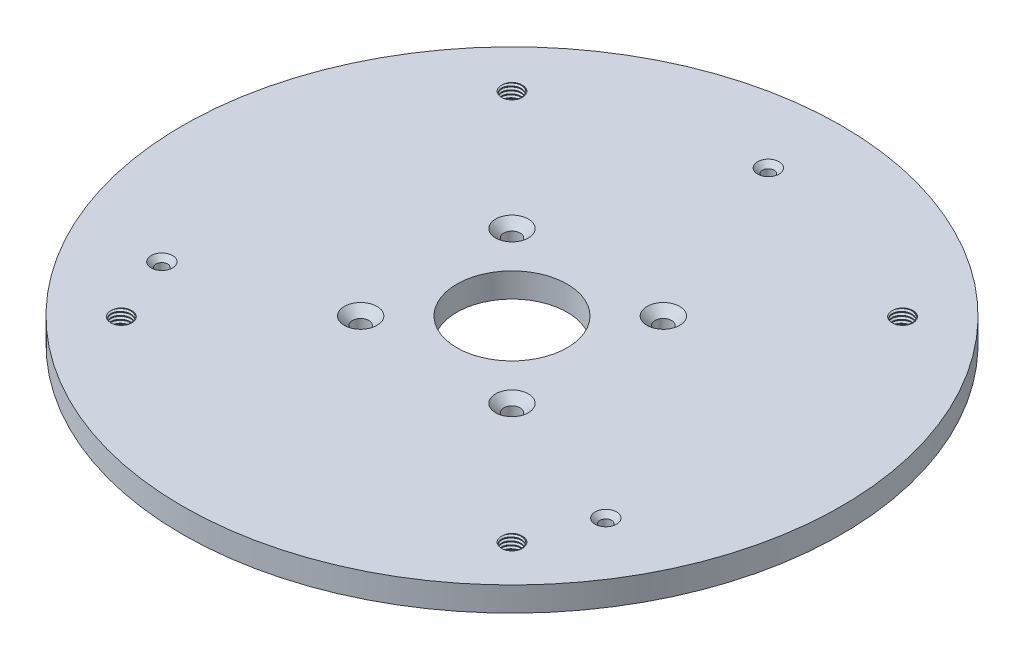
from build123d import *

# Parameters (mm, degrees)
SKETCH1_R                                           = 67.5
BOSS_EXTRUDE1_DEPTH                                 = 5
CSK_FOR_M3_SFHCS1_D                                 = 3.4
CSK_FOR_M3_SFHCS1_CSINK_D                           = 6.72
CSK_FOR_M3_SFHCS1_CSINK_ANGLE                       = 90
SKETCH5_R                                           = 11.3
CUT_EXTRUDE1_DEPTH                                  = 96.590271472
F_4_0MM_DOWEL_HOLE1_D                               = 4
F_4_0MM_DOWEL_HOLE1_DEPTH                           = 15
F_4_0MM_DOWEL_HOLE1_TIP                             = 1.201721238
THREAD1_PITCH                                       = 0.7
THREAD2_PITCH                                       = 0.7
THREAD3_PITCH                                       = 0.7
THREAD4_PITCH                                       = 0.7
CSK_FOR_M2_COUNTERSUNK_FLAT_HEAD_SCREW1_D           = 2.4
CSK_FOR_M2_COUNTERSUNK_FLAT_HEAD_SCREW1_CSINK_D     = 4.4
CSK_FOR_M2_COUNTERSUNK_FLAT_HEAD_SCREW1_CSINK_ANGLE = 90


with BuildPart() as part:
    # Sketch1 → Boss-Extrude1 (new body)
    with BuildSketch(Plane(origin=(0, 0, 0), x_dir=(1, 0, 0), z_dir=(0, 1, 0))):
        with Locations(Location((0, 0, 0), (0, 0, 270))):
            Circle(SKETCH1_R)
    extrude(amount=BOSS_EXTRUDE1_DEPTH)

    # CSK for M3 SFHCS1 (through all)
    with Locations(Plane(origin=(0, 5, 0), x_dir=(1, 0, 0), z_dir=(0, 1, 0))):
        with Locations((-15.5, 15.5), (15.5, 15.5), (15.5, -15.5), (-15.5, -15.5)):
            CounterSinkHole(CSK_FOR_M3_SFHCS1_D / 2, CSK_FOR_M3_SFHCS1_CSINK_D / 2, counter_sink_angle=CSK_FOR_M3_SFHCS1_CSINK_ANGLE)

    # Sketch5 → Cut-Extrude1 (cut, through all)
    with BuildSketch(Plane(origin=(0, 5, 0), x_dir=(1, 0, 0), z_dir=(0, 1, 0))):
        with Locations(Location((0, 0, 0), (0, 0, 270))):
            Circle(SKETCH5_R)
    extrude(amount=-CUT_EXTRUDE1_DEPTH, mode=Mode.SUBTRACT)

    # Ø4.0mm Dowel Hole1
    with Locations(Plane(origin=(0, 5, 0), x_dir=(1, 0, 0), z_dir=(0, 1, 0))):
        with Locations((40, 40), (-40, 40), (-40, -40), (40, -40)):
            Hole(F_4_0MM_DOWEL_HOLE1_D / 2, depth=F_4_0MM_DOWEL_HOLE1_DEPTH)
            with Locations((0, 0, -(F_4_0MM_DOWEL_HOLE1_DEPTH + F_4_0MM_DOWEL_HOLE1_TIP / 2))):  # 118° drill point
                Cone(0, F_4_0MM_DOWEL_HOLE1_D / 2, F_4_0MM_DOWEL_HOLE1_TIP, mode=Mode.SUBTRACT)

    # Thread1: the profile of Thread Profile2 profile screwed along a right-hand helix of 8.142857 turns, 6 arcs to a turn; built about Z, then put on its axis
    thread1_z = Axis((0, 0, 0), (0, 0, 1))
    thread1_corners = [(1.9997, 1e-09, -0.000173205), (2.378886112, 1e-09, 0.218749999), (2.378886112, 1e-09, 0.306249999), (1.9997, 1e-09, 0.525173203)]
    with BuildLine(mode=Mode.PRIVATE) as thread1_profile:
        Line(thread1_corners[0], thread1_corners[1])
        Line(thread1_corners[1], thread1_corners[2])
        Line(thread1_corners[2], thread1_corners[3])
        Line(thread1_corners[3], thread1_corners[0])
    thread1_cap = Face(thread1_profile.wire())
    thread1_turn_angles = [0, 30, 60, 90, 120, 150, 180, 210, 240, 270, 300, 330, 360]
    thread1_turn_weights = [1, 0.8660254037844387, 1, 0.8660254037844387, 1, 0.8660254037844387, 1, 0.8660254037844387, 1, 0.8660254037844387, 1, 0.8660254037844387, 1]
    thread1_turn_rails = [Edge.make_bspline([Vector(p[0], p[1], 0).rotate(thread1_z, thread1_turn_angles[k]) / thread1_turn_weights[k] + Vector(0, 0, p[2] + THREAD1_PITCH * thread1_turn_angles[k] / 360) for k in range(13)], [0, 0, 0, 1, 1, 2, 2, 3, 3, 4, 4, 5, 5, 6, 6, 6], 2, thread1_turn_weights) for p in thread1_corners]
    thread1_turn_sides = [Face.make_surface_from_curves(thread1_turn_rails[p[0]], thread1_turn_rails[p[1]]) for p in [(0, 1), (1, 2), (2, 3), (3, 0)]]
    thread1_last_angles = [2880, 2905.714285714, 2931.428571429]
    thread1_last_weights = [1, 0.9009688679024135, 1]
    thread1_last_rails = [Edge.make_bspline([Vector(p[0], p[1], 0).rotate(thread1_z, thread1_last_angles[k]) / thread1_last_weights[k] + Vector(0, 0, p[2] + THREAD1_PITCH * thread1_last_angles[k] / 360) for k in range(3)], [0, 0, 0, 1, 1, 1], 2, thread1_last_weights) for p in thread1_corners]
    thread1_last_sides = [Face.make_surface_from_curves(thread1_last_rails[p[0]], thread1_last_rails[p[1]]) for p in [(0, 1), (1, 2), (2, 3), (3, 0)]]
    thread1 = Plane(origin=(-40, 5.7, 40), x_dir=(-0.999847695, 0, -0.017452406), z_dir=(0, -1, 0)) * Solid(Shell([*[p.moved(Location((0, 0, THREAD1_PITCH * i))) for i in range(8) for p in thread1_turn_sides], *thread1_last_sides, thread1_cap, thread1_cap.rotate(thread1_z, 2931.428571429).moved(Location((0, 0, THREAD1_PITCH * 2931.428571429 / 360)))]))
    add(thread1, mode=Mode.SUBTRACT)

    # Thread2: the profile of Thread Profile4 profile screwed along a right-hand helix of 8.142857 turns, 6 arcs to a turn; built about Z, then put on its axis
    thread2_z = Axis((0, 0, 0), (0, 0, 1))
    thread2_corners = [(1.9997, 0, -0.000173205), (2.378886112, 0, 0.218749999), (2.378886112, 0, 0.306249999), (1.9997, 0, 0.525173203)]
    with BuildLine(mode=Mode.PRIVATE) as thread2_profile:
        Line(thread2_corners[0], thread2_corners[1])
        Line(thread2_corners[1], thread2_corners[2])
        Line(thread2_corners[2], thread2_corners[3])
        Line(thread2_corners[3], thread2_corners[0])
    thread2_cap = Face(thread2_profile.wire())
    thread2_turn_angles = [0, 30, 60, 90, 120, 150, 180, 210, 240, 270, 300, 330, 360]
    thread2_turn_weights = [1, 0.8660254037844387, 1, 0.8660254037844387, 1, 0.8660254037844387, 1, 0.8660254037844387, 1, 0.8660254037844387, 1, 0.8660254037844387, 1]
    thread2_turn_rails = [Edge.make_bspline([Vector(p[0], p[1], 0).rotate(thread2_z, thread2_turn_angles[k]) / thread2_turn_weights[k] + Vector(0, 0, p[2] + THREAD2_PITCH * thread2_turn_angles[k] / 360) for k in range(13)], [0, 0, 0, 1, 1, 2, 2, 3, 3, 4, 4, 5, 5, 6, 6, 6], 2, thread2_turn_weights) for p in thread2_corners]
    thread2_turn_sides = [Face.make_surface_from_curves(thread2_turn_rails[p[0]], thread2_turn_rails[p[1]]) for p in [(0, 1), (1, 2), (2, 3), (3, 0)]]
    thread2_last_angles = [2880, 2905.714285714, 2931.428571429]
    thread2_last_weights = [1, 0.9009688679024135, 1]
    thread2_last_rails = [Edge.make_bspline([Vector(p[0], p[1], 0).rotate(thread2_z, thread2_last_angles[k]) / thread2_last_weights[k] + Vector(0, 0, p[2] + THREAD2_PITCH * thread2_last_angles[k] / 360) for k in range(3)], [0, 0, 0, 1, 1, 1], 2, thread2_last_weights) for p in thread2_corners]
    thread2_last_sides = [Face.make_surface_from_curves(thread2_last_rails[p[0]], thread2_last_rails[p[1]]) for p in [(0, 1), (1, 2), (2, 3), (3, 0)]]
    thread2 = Plane(origin=(40, 5.7, 40), x_dir=(-1, 0, 0), z_dir=(0, -1, 0)) * Solid(Shell([*[p.moved(Location((0, 0, THREAD2_PITCH * i))) for i in range(8) for p in thread2_turn_sides], *thread2_last_sides, thread2_cap, thread2_cap.rotate(thread2_z, 2931.428571429).moved(Location((0, 0, THREAD2_PITCH * 2931.428571429 / 360)))]))
    add(thread2, mode=Mode.SUBTRACT)

    # Thread3: the profile of Thread Profile5 profile screwed along a right-hand helix of 8.142857 turns, 6 arcs to a turn; built about Z, then put on its axis
    thread3_z = Axis((0, 0, 0), (0, 0, 1))
    thread3_corners = [(1.9997, 0, -0.000173205), (2.378886112, 0, 0.218749999), (2.378886112, 0, 0.306249999), (1.9997, 0, 0.525173203)]
    with BuildLine(mode=Mode.PRIVATE) as thread3_profile:
        Line(thread3_corners[0], thread3_corners[1])
        Line(thread3_corners[1], thread3_corners[2])
        Line(thread3_corners[2], thread3_corners[3])
        Line(thread3_corners[3], thread3_corners[0])
    thread3_cap = Face(thread3_profile.wire())
    thread3_turn_angles = [0, 30, 60, 90, 120, 150, 180, 210, 240, 270, 300, 330, 360]
    thread3_turn_weights = [1, 0.8660254037844387, 1, 0.8660254037844387, 1, 0.8660254037844387, 1, 0.8660254037844387, 1, 0.8660254037844387, 1, 0.8660254037844387, 1]
    thread3_turn_rails = [Edge.make_bspline([Vector(p[0], p[1], 0).rotate(thread3_z, thread3_turn_angles[k]) / thread3_turn_weights[k] + Vector(0, 0, p[2] + THREAD3_PITCH * thread3_turn_angles[k] / 360) for k in range(13)], [0, 0, 0, 1, 1, 2, 2, 3, 3, 4, 4, 5, 5, 6, 6, 6], 2, thread3_turn_weights) for p in thread3_corners]
    thread3_turn_sides = [Face.make_surface_from_curves(thread3_turn_rails[p[0]], thread3_turn_rails[p[1]]) for p in [(0, 1), (1, 2), (2, 3), (3, 0)]]
    thread3_last_angles = [2880, 2905.714285714, 2931.428571429]
    thread3_last_weights = [1, 0.9009688679024135, 1]
    thread3_last_rails = [Edge.make_bspline([Vector(p[0], p[1], 0).rotate(thread3_z, thread3_last_angles[k]) / thread3_last_weights[k] + Vector(0, 0, p[2] + THREAD3_PITCH * thread3_last_angles[k] / 360) for k in range(3)], [0, 0, 0, 1, 1, 1], 2, thread3_last_weights) for p in thread3_corners]
    thread3_last_sides = [Face.make_surface_from_curves(thread3_last_rails[p[0]], thread3_last_rails[p[1]]) for p in [(0, 1), (1, 2), (2, 3), (3, 0)]]
    thread3 = Plane(origin=(40, 5.7, -40), x_dir=(-1, 0, 0), z_dir=(0, -1, 0)) * Solid(Shell([*[p.moved(Location((0, 0, THREAD3_PITCH * i))) for i in range(8) for p in thread3_turn_sides], *thread3_last_sides, thread3_cap, thread3_cap.rotate(thread3_z, 2931.428571429).moved(Location((0, 0, THREAD3_PITCH * 2931.428571429 / 360)))]))
    add(thread3, mode=Mode.SUBTRACT)

    # Thread4: the profile of Thread Profile6 profile screwed along a right-hand helix of 8.142857 turns, 6 arcs to a turn; built about Z, then put on its axis
    thread4_z = Axis((0, 0, 0), (0, 0, 1))
    thread4_corners = [(1.9997, 0, -0.000173205), (2.378886112, 0, 0.218749999), (2.378886112, 0, 0.306249999), (1.9997, 0, 0.525173203)]
    with BuildLine(mode=Mode.PRIVATE) as thread4_profile:
        Line(thread4_corners[0], thread4_corners[1])
        Line(thread4_corners[1], thread4_corners[2])
        Line(thread4_corners[2], thread4_corners[3])
        Line(thread4_corners[3], thread4_corners[0])
    thread4_cap = Face(thread4_profile.wire())
    thread4_turn_angles = [0, 30, 60, 90, 120, 150, 180, 210, 240, 270, 300, 330, 360]
    thread4_turn_weights = [1, 0.8660254037844387, 1, 0.8660254037844387, 1, 0.8660254037844387, 1, 0.8660254037844387, 1, 0.8660254037844387, 1, 0.8660254037844387, 1]
    thread4_turn_rails = [Edge.make_bspline([Vector(p[0], p[1], 0).rotate(thread4_z, thread4_turn_angles[k]) / thread4_turn_weights[k] + Vector(0, 0, p[2] + THREAD4_PITCH * thread4_turn_angles[k] / 360) for k in range(13)], [0, 0, 0, 1, 1, 2, 2, 3, 3, 4, 4, 5, 5, 6, 6, 6], 2, thread4_turn_weights) for p in thread4_corners]
    thread4_turn_sides = [Face.make_surface_from_curves(thread4_turn_rails[p[0]], thread4_turn_rails[p[1]]) for p in [(0, 1), (1, 2), (2, 3), (3, 0)]]
    thread4_last_angles = [2880, 2905.714285714, 2931.428571429]
    thread4_last_weights = [1, 0.9009688679024135, 1]
    thread4_last_rails = [Edge.make_bspline([Vector(p[0], p[1], 0).rotate(thread4_z, thread4_last_angles[k]) / thread4_last_weights[k] + Vector(0, 0, p[2] + THREAD4_PITCH * thread4_last_angles[k] / 360) for k in range(3)], [0, 0, 0, 1, 1, 1], 2, thread4_last_weights) for p in thread4_corners]
    thread4_last_sides = [Face.make_surface_from_curves(thread4_last_rails[p[0]], thread4_last_rails[p[1]]) for p in [(0, 1), (1, 2), (2, 3), (3, 0)]]
    thread4 = Plane(origin=(-40, 5.7, -40), x_dir=(-1, 0, 0), z_dir=(0, -1, 0)) * Solid(Shell([*[p.moved(Location((0, 0, THREAD4_PITCH * i))) for i in range(8) for p in thread4_turn_sides], *thread4_last_sides, thread4_cap, thread4_cap.rotate(thread4_z, 2931.428571429).moved(Location((0, 0, THREAD4_PITCH * 2931.428571429 / 360)))]))
    add(thread4, mode=Mode.SUBTRACT)

    # CSK for M2 Countersunk Flat Head Screw1 (through all)
    with Locations(Plane(origin=(0, 5, 0), x_dir=(1, 0, 0), z_dir=(0, 1, 0))):
        with Locations((0, 52.5), (45.466333699, -26.25), (-45.466333699, -26.25)):
            CounterSinkHole(CSK_FOR_M2_COUNTERSUNK_FLAT_HEAD_SCREW1_D / 2, CSK_FOR_M2_COUNTERSUNK_FLAT_HEAD_SCREW1_CSINK_D / 2, counter_sink_angle=CSK_FOR_M2_COUNTERSUNK_FLAT_HEAD_SCREW1_CSINK_ANGLE)


solid = part.part
